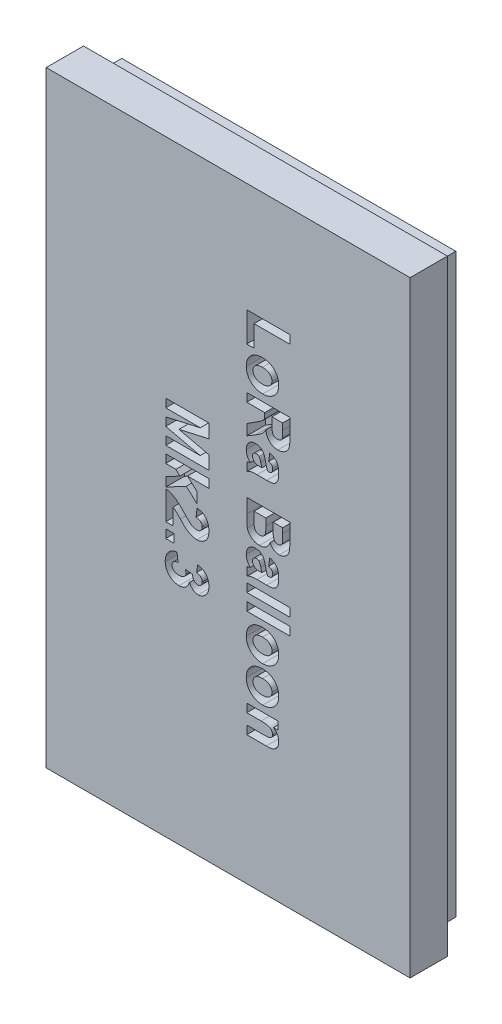
from build123d import *

# Parameters (mm, degrees)
SKETCH1_W   = 39
SKETCH1_H   = 65
BASE_DEPTH  = 4
SKETCH2_W   = 35.8
SKETCH2_H   = 61.8
SKETCH2_W_2 = 32.2
SKETCH2_H_2 = 58.2
MOUNT_DEPTH = 2.5
SKETCH3_W   = 4.622973633
SKETCH3_H   = 0.900579279
SKETCH3_W_2 = 0.900579279
LOGO_DEPTH  = 2


with BuildPart() as part:
    # Sketch1 → Base (new body)
    with BuildSketch(Plane.XY):
        with Locations((19.5, 32.5)):
            Rectangle(SKETCH1_W, SKETCH1_H)
    extrude(amount=BASE_DEPTH)

    # Sketch2 → Mount (add)
    with BuildSketch(Plane(origin=(0, 0, 0), x_dir=(-1, 0, 0), z_dir=(0, 0, -1))):
        with Locations((-19.5, 32.5)):
            Rectangle(SKETCH2_W, SKETCH2_H)
        with Locations((-19.5, 32.5)):
            Rectangle(SKETCH2_W_2, SKETCH2_H_2, mode=Mode.SUBTRACT)
    extrude(amount=MOUNT_DEPTH)

    # Sketch3 → Logo (cut)
    # profile 1 of 16: a face of its own
    with BuildSketch(Plane.XY.offset(4)):
        with BuildLine():
            Line((21.5, 13.827989613), (21.5, 14.728568892))
            Line((21.5, 14.728568892), (23.218605458, 14.728568892))
            add(Edge.make_bspline(
                [(23.218605458, 14.728568892), (23.259881981, 14.728831135), (23.33868675, 14.729331807), (23.451598313, 14.730839729), (23.553850951, 14.734796734), (23.645484529, 14.739400216), (23.726240729, 14.744643751), (23.796064397, 14.751967868), (23.8548999, 14.761242262), (23.918206403, 14.774449165), (23.986420727, 14.797186347), (24.058026651, 14.834969014), (24.120869879, 14.881200737), (24.171139913, 14.938262475), (24.211805696, 15.001178622), (24.241236399, 15.069258199), (24.258624837, 15.141718902), (24.26071657, 15.19127334), (24.261776456, 15.216382668)],
                knots=[0, 0, 0, 0, 1.518468101, 2.899045743, 4.15374029, 5.282521764, 6.274203078, 7.130400985, 7.864176346, 8.464331223, 9.50833919, 10.496277288, 11.432641907, 12.361201578, 13.276990523, 14.178728215, 15.077158116, 16, 16, 16, 16], degree=3))
            add(Edge.make_bspline(
                [(24.261776456, 15.216382668), (24.260395831, 15.249045483), (24.257666872, 15.313607151), (24.234037383, 15.407271244), (24.197101841, 15.496591675), (24.144264328, 15.578920944), (24.080370598, 15.65495619), (24.001643315, 15.716835868), (23.913268019, 15.768500299), (23.829602888, 15.800766323), (23.752735925, 15.819850143), (23.683087132, 15.834354223), (23.601504403, 15.844707565), (23.508648449, 15.854483827), (23.404062142, 15.860137931), (23.288092488, 15.866422281), (23.160451233, 15.868706073), (23.071635516, 15.869098278), (23.025356154, 15.869302646)],
                knots=[0, 0, 0, 0, 0.987208667, 1.951327175, 2.905781144, 3.900987558, 4.900863378, 5.897104334, 6.91491578, 7.990576578, 8.596595857, 9.311207409, 10.142408639, 11.084155198, 12.136793968, 13.311756484, 14.59923223, 16, 16, 16, 16], degree=3))
            Line((23.025356154, 15.869302646), (21.5, 15.869302646))
            Line((21.5, 15.869302646), (21.5, 16.769881925))
            Line((21.5, 16.769881925), (24.862162642, 16.769881925))
            Line((24.862162642, 16.769881925), (24.862162642, 15.929341264))
            Line((24.862162642, 15.929341264), (24.369658349, 15.929341264))
            add(Edge.make_bspline(
                [(24.369658349, 15.929341264), (24.413616533, 15.894934077), (24.49957413, 15.827652883), (24.611985052, 15.713471029), (24.708270507, 15.593463209), (24.786728659, 15.466293298), (24.847225588, 15.331834554), (24.890517621, 15.190698826), (24.917784325, 15.04263487), (24.920714558, 14.941324286), (24.922201261, 14.88992268)],
                knots=[0, 0, 0, 0, 1.093461536, 2.13819855, 3.132977593, 4.104514142, 5.059389303, 6.015385568, 6.993072912, 8, 8, 8, 8], degree=3))
            add(Edge.make_bspline(
                [(24.922201261, 14.88992268), (24.920317919, 14.831313036), (24.91666388, 14.717599245), (24.885696808, 14.553948097), (24.832707603, 14.404772438), (24.760298213, 14.271241837), (24.672194055, 14.154654125), (24.570901367, 14.05627349), (24.456656392, 13.978688927), (24.352110831, 13.929286536), (24.260861224, 13.899872418), (24.185114665, 13.880160253), (24.101698698, 13.864370635), (24.011142966, 13.851834088), (23.913646699, 13.840088199), (23.808775892, 13.832735474), (23.696745732, 13.829517962), (23.619489692, 13.828508526), (23.579775273, 13.827989613)],
                knots=[0, 0, 0, 0, 1.428465185, 2.77149258, 4.042602701, 5.274402086, 6.460971935, 7.593531473, 8.701853732, 9.81394723, 10.399934156, 11.038034574, 11.721500487, 12.468854998, 13.267186475, 14.115831328, 15.031419898, 16, 16, 16, 16], degree=3))
            Line((23.579775273, 13.827989613), (21.5, 13.827989613))
        make_face()
    # profile 2 of 16: a face of its own
    with BuildSketch(Plane.XY.offset(4)):
        with BuildLine():
            add(Edge.make_bspline(
                [(23.227986492, 20.792469371), (23.268340591, 20.791649103), (23.348241235, 20.790024982), (23.466831788, 20.780076026), (23.582597294, 20.760667345), (23.695714536, 20.735577714), (23.806416527, 20.704054597), (23.913363069, 20.662763939), (24.018572563, 20.616656969), (24.119538873, 20.561646768), (24.216642118, 20.502333444), (24.307982668, 20.437575514), (24.392270804, 20.367601326), (24.471764649, 20.295098865), (24.542963196, 20.215915146), (24.610173753, 20.134237696), (24.668761487, 20.046157916), (24.722741328, 19.955376952), (24.769340893, 19.860054279), (24.810963092, 19.762308062), (24.84421655, 19.660597063), (24.874003462, 19.55733923), (24.895076066, 19.45021958), (24.911226693, 19.340690197), (24.920807626, 19.227884963), (24.921733394, 19.151744363), (24.922201261, 19.113264257)],
                knots=[0, 0, 0, 0, 1.087797627, 2.153826546, 3.204146119, 4.249074796, 5.276002369, 6.302929943, 7.33671768, 8.369955531, 9.399197913, 10.402506754, 11.384561342, 12.350717656, 13.299250364, 14.252266119, 15.199037181, 16.147307724, 17.097187567, 18.056740571, 19.008264324, 19.97962709, 20.951574749, 21.948063114, 22.962987564, 24, 24, 24, 24], degree=3))
            add(Edge.make_bspline(
                [(24.922201261, 19.113264257), (24.920492435, 19.049406197), (24.917163302, 18.924997983), (24.89380331, 18.743531178), (24.853287611, 18.572907267), (24.797267351, 18.412070903), (24.72326136, 18.262429877), (24.634810544, 18.12211449), (24.529143938, 17.993062965), (24.40795289, 17.876913485), (24.277240101, 17.77213606), (24.139130934, 17.681191856), (23.996080966, 17.603716584), (23.847473094, 17.540550081), (23.693540221, 17.490172893), (23.533372162, 17.45646932), (23.368435672, 17.433388836), (23.256523789, 17.431342928), (23.199843389, 17.430306729)],
                knots=[0, 0, 0, 0, 1.136040707, 2.213233445, 3.248238065, 4.25119704, 5.236487175, 6.211911138, 7.196384178, 8.195725979, 9.1931767, 10.173001403, 11.133846892, 12.083513917, 13.042376269, 14.010298635, 14.992269034, 16, 16, 16, 16], degree=3))
            add(Edge.make_bspline(
                [(23.199843389, 17.430306729), (23.157599655, 17.430988044), (23.0738988, 17.432337985), (22.949923499, 17.444321062), (22.828866965, 17.461530889), (22.710806659, 17.487328516), (22.595913097, 17.519608262), (22.484212787, 17.560631027), (22.375843769, 17.608314659), (22.270645012, 17.662470291), (22.171228883, 17.723480762), (22.076479739, 17.787925195), (21.989613644, 17.858593723), (21.908343846, 17.933026069), (21.833120613, 18.011749179), (21.764474284, 18.095492707), (21.702322369, 18.1838856), (21.647348245, 18.276666737), (21.598380596, 18.372514362), (21.556075444, 18.471239084), (21.52061437, 18.572238067), (21.49154767, 18.675378154), (21.4673821, 18.780414605), (21.452433072, 18.888433003), (21.441007522, 18.998259779), (21.440311587, 19.072269111), (21.439961381, 19.109511844)],
                knots=[0, 0, 0, 0, 1.117558833, 2.214307803, 3.293244786, 4.351421184, 5.409597582, 6.448807362, 7.497331125, 8.540978692, 9.576922014, 10.582241184, 11.570837346, 12.537122916, 13.496974449, 14.449450387, 15.399839374, 16.353464778, 17.300823134, 18.246083241, 19.193441597, 20.131138339, 21.080698472, 22.042616426, 23.015011865, 24, 24, 24, 24], degree=3))
            add(Edge.make_bspline(
                [(21.439961381, 19.109511844), (21.441434818, 19.168676914), (21.444329398, 19.284907241), (21.466190044, 19.455499274), (21.502637169, 19.618208719), (21.553836141, 19.773292057), (21.618260134, 19.921111712), (21.698440035, 20.060830211), (21.79447105, 20.191671601), (21.902499007, 20.315346139), (22.024251963, 20.428480511), (22.159878703, 20.526179772), (22.308067385, 20.608407676), (22.468125433, 20.676011805), (22.640780217, 20.728460395), (22.825794291, 20.76565684), (23.022910429, 20.788417035), (23.158504181, 20.79109639), (23.227986492, 20.792469371)],
                knots=[0, 0, 0, 0, 1.024594995, 2.012826322, 2.973358778, 3.908543225, 4.837401023, 5.761810751, 6.69243552, 7.644223827, 8.602462928, 9.564551743, 10.532007457, 11.531954493, 12.568505162, 13.651979317, 14.796803673, 16, 16, 16, 16], degree=3))
        make_face()
        with BuildLine():
            add(Edge.make_bspline(
                [(23.181081321, 19.891890092), (23.140418132, 19.891081204), (23.061457429, 19.889510486), (22.946509384, 19.879930059), (22.839622498, 19.86021699), (22.739486697, 19.837275165), (22.647961982, 19.803332482), (22.563118232, 19.76475678), (22.486368037, 19.717306566), (22.418159022, 19.662990028), (22.358227437, 19.603526395), (22.305063926, 19.541372853), (22.260023454, 19.476171936), (22.223835025, 19.407386441), (22.195763008, 19.335913587), (22.174765469, 19.261215875), (22.162389452, 19.183413262), (22.161082475, 19.130506093), (22.160424805, 19.103883223)],
                knots=[0, 0, 0, 0, 1.347985487, 2.617548842, 3.817114289, 4.948286482, 6.017057593, 7.046407217, 8.032969353, 8.999289909, 9.930051738, 10.827140183, 11.706817169, 12.550594062, 13.397420762, 14.247349517, 15.118066881, 16, 16, 16, 16], degree=3))
            add(Edge.make_bspline(
                [(22.160424805, 19.103883223), (22.161082172, 19.077884544), (22.162388524, 19.026218755), (22.174768649, 18.950280251), (22.195758212, 18.877442866), (22.224167513, 18.807226876), (22.260561859, 18.739594255), (22.306359128, 18.675696195), (22.359147439, 18.61418118), (22.42010437, 18.556389987), (22.488357165, 18.502259842), (22.565874129, 18.456493853), (22.650982245, 18.418080105), (22.743354127, 18.386304717), (22.843361939, 18.360760783), (22.951359004, 18.343351788), (23.067059726, 18.333127611), (23.146662829, 18.331647878), (23.187648045, 18.330886009)],
                knots=[0, 0, 0, 0, 0.86498205, 1.718932724, 2.552529207, 3.383717481, 4.236080589, 5.102502034, 5.995588818, 6.930639414, 7.894730959, 8.889086482, 9.918564038, 10.998334367, 12.1369617, 13.350269694, 14.635734454, 16, 16, 16, 16], degree=3))
            add(Edge.make_bspline(
                [(23.187648045, 18.330886009), (23.227688932, 18.331684219), (23.305407142, 18.333233522), (23.418448526, 18.342948554), (23.523973479, 18.362246362), (23.622320571, 18.387010265), (23.713524667, 18.419080565), (23.797316766, 18.458372586), (23.873991238, 18.505367542), (23.942107737, 18.560129899), (24.003044034, 18.618891112), (24.055828048, 18.681339245), (24.101619145, 18.746185087), (24.138009283, 18.814749178), (24.166408615, 18.885901469), (24.187393837, 18.959673844), (24.199774112, 19.036543003), (24.201080471, 19.088829606), (24.201737837, 19.115140464)],
                knots=[0, 0, 0, 0, 1.337232047, 2.595528913, 3.783536199, 4.915617704, 5.97906533, 7.006690339, 8.000659516, 8.974235141, 9.919454987, 10.823278711, 11.700968276, 12.565199868, 13.408680491, 14.254935835, 15.121875735, 16, 16, 16, 16], degree=3))
            add(Edge.make_bspline(
                [(24.201737837, 19.115140464), (24.201125638, 19.141458654), (24.199923414, 19.193141825), (24.187117275, 19.269303374), (24.1666105, 19.342265893), (24.137959369, 19.412718986), (24.10165055, 19.480405772), (24.055496899, 19.544317908), (24.003354012, 19.606692169), (23.942036507, 19.664507638), (23.873587127, 19.718599202), (23.796542842, 19.765081165), (23.712370979, 19.804891994), (23.620397249, 19.836579931), (23.521262796, 19.861774997), (23.414268616, 19.879544071), (23.300102491, 19.889596023), (23.221439565, 19.891112209), (23.181081321, 19.891890092)],
                knots=[0, 0, 0, 0, 0.8777483, 1.723705717, 2.56959874, 3.403036217, 4.257705828, 5.126471818, 6.029908573, 6.967489424, 7.934189811, 8.936630112, 9.963815147, 11.036651848, 12.178360317, 13.374360467, 14.652907978, 16, 16, 16, 16], degree=3))
        make_face(mode=Mode.SUBTRACT)
    # profile 3 of 16: a face of its own
    with BuildSketch(Plane.XY.offset(4)):
        with BuildLine():
            add(Edge.make_bspline(
                [(23.227986492, 24.634940962), (23.268340591, 24.634120694), (23.348241235, 24.632496573), (23.466831788, 24.622547617), (23.582597294, 24.603138936), (23.695714536, 24.578049305), (23.806416527, 24.546526188), (23.913363069, 24.50523553), (24.018572563, 24.45912856), (24.119538873, 24.404118359), (24.216642118, 24.344805035), (24.307982668, 24.280047105), (24.392270804, 24.210072917), (24.471764649, 24.137570456), (24.542963196, 24.058386737), (24.610173753, 23.976709287), (24.668761487, 23.888629507), (24.722741328, 23.797848543), (24.769340893, 23.70252587), (24.810963092, 23.604779653), (24.84421655, 23.503068653), (24.874003462, 23.399810821), (24.895076066, 23.292691171), (24.911226693, 23.183161788), (24.920807626, 23.070356554), (24.921733394, 22.994215954), (24.922201261, 22.955735848)],
                knots=[0, 0, 0, 0, 1.087797627, 2.153826546, 3.204146119, 4.249074796, 5.276002369, 6.302929943, 7.33671768, 8.369955531, 9.399197913, 10.402506754, 11.384561342, 12.350717656, 13.299250364, 14.252266119, 15.199037181, 16.147307724, 17.097187567, 18.056740571, 19.008264324, 19.97962709, 20.951574749, 21.948063114, 22.962987564, 24, 24, 24, 24], degree=3))
            add(Edge.make_bspline(
                [(24.922201261, 22.955735848), (24.920492435, 22.891877788), (24.917163302, 22.767469574), (24.89380331, 22.586002768), (24.853287611, 22.415378858), (24.797267351, 22.254542494), (24.72326136, 22.104901468), (24.634810544, 21.964586081), (24.529143938, 21.835534556), (24.40795289, 21.719385076), (24.277240101, 21.614607651), (24.139130934, 21.523663446), (23.996080966, 21.446188175), (23.847473094, 21.383021672), (23.693540221, 21.332644484), (23.533372162, 21.298940911), (23.368435672, 21.275860427), (23.256523789, 21.273814519), (23.199843389, 21.27277832)],
                knots=[0, 0, 0, 0, 1.136040707, 2.213233445, 3.248238065, 4.25119704, 5.236487175, 6.211911138, 7.196384178, 8.195725979, 9.1931767, 10.173001403, 11.133846892, 12.083513917, 13.042376269, 14.010298635, 14.992269034, 16, 16, 16, 16], degree=3))
            add(Edge.make_bspline(
                [(23.199843389, 21.27277832), (23.157599655, 21.273459635), (23.0738988, 21.274809576), (22.949923499, 21.286792653), (22.828866965, 21.30400248), (22.710806659, 21.329800107), (22.595913097, 21.362079853), (22.484212787, 21.403102618), (22.375843769, 21.45078625), (22.270645012, 21.504941881), (22.171228883, 21.565952353), (22.076479739, 21.630396786), (21.989613644, 21.701065314), (21.908343846, 21.77549766), (21.833120613, 21.85422077), (21.764474284, 21.937964298), (21.702322369, 22.026357191), (21.647348245, 22.119138328), (21.598380596, 22.214985953), (21.556075444, 22.313710675), (21.52061437, 22.414709658), (21.49154767, 22.517849745), (21.4673821, 22.622886196), (21.452433072, 22.730904594), (21.441007522, 22.84073137), (21.440311587, 22.914740702), (21.439961381, 22.951983435)],
                knots=[0, 0, 0, 0, 1.117558833, 2.214307803, 3.293244786, 4.351421184, 5.409597582, 6.448807362, 7.497331125, 8.540978692, 9.576922014, 10.582241184, 11.570837346, 12.537122916, 13.496974449, 14.449450387, 15.399839374, 16.353464778, 17.300823134, 18.246083241, 19.193441597, 20.131138339, 21.080698472, 22.042616426, 23.015011865, 24, 24, 24, 24], degree=3))
            add(Edge.make_bspline(
                [(21.439961381, 22.951983435), (21.441434818, 23.011148505), (21.444329398, 23.127378832), (21.466190044, 23.297970865), (21.502637169, 23.46068031), (21.553836141, 23.615763648), (21.618260134, 23.763583303), (21.698440035, 23.903301802), (21.79447105, 24.034143192), (21.902499007, 24.15781773), (22.024251963, 24.270952101), (22.159878703, 24.368651363), (22.308067385, 24.450879267), (22.468125433, 24.518483396), (22.640780217, 24.570931986), (22.825794291, 24.608128431), (23.022910429, 24.630888625), (23.158504181, 24.63356798), (23.227986492, 24.634940962)],
                knots=[0, 0, 0, 0, 1.024594995, 2.012826322, 2.973358778, 3.908543225, 4.837401023, 5.761810751, 6.69243552, 7.644223827, 8.602462928, 9.564551743, 10.532007457, 11.531954493, 12.568505162, 13.651979317, 14.796803673, 16, 16, 16, 16], degree=3))
        make_face()
        with BuildLine():
            add(Edge.make_bspline(
                [(23.181081321, 23.734361683), (23.140418132, 23.733552795), (23.061457429, 23.731982077), (22.946509384, 23.72240165), (22.839622498, 23.70268858), (22.739486697, 23.679746756), (22.647961982, 23.645804072), (22.563118232, 23.607228371), (22.486368037, 23.559778157), (22.418159022, 23.505461619), (22.358227437, 23.445997986), (22.305063926, 23.383844444), (22.260023454, 23.318643527), (22.223835025, 23.249858032), (22.195763008, 23.178385178), (22.174765469, 23.103687466), (22.162389452, 23.025884853), (22.161082475, 22.972977683), (22.160424805, 22.946354814)],
                knots=[0, 0, 0, 0, 1.347985487, 2.617548842, 3.817114289, 4.948286482, 6.017057593, 7.046407217, 8.032969353, 8.999289909, 9.930051738, 10.827140183, 11.706817169, 12.550594062, 13.397420762, 14.247349517, 15.118066881, 16, 16, 16, 16], degree=3))
            add(Edge.make_bspline(
                [(22.160424805, 22.946354814), (22.161082172, 22.920356135), (22.162388524, 22.868690346), (22.174768649, 22.792751842), (22.195758212, 22.719914457), (22.224167513, 22.649698467), (22.260561859, 22.582065846), (22.306359128, 22.518167786), (22.359147439, 22.456652771), (22.42010437, 22.398861578), (22.488357165, 22.344731433), (22.565874129, 22.298965444), (22.650982245, 22.260551696), (22.743354127, 22.228776308), (22.843361939, 22.203232374), (22.951359004, 22.185823379), (23.067059726, 22.175599201), (23.146662829, 22.174119469), (23.187648045, 22.173357599)],
                knots=[0, 0, 0, 0, 0.86498205, 1.718932724, 2.552529207, 3.383717481, 4.236080589, 5.102502034, 5.995588818, 6.930639414, 7.894730959, 8.889086482, 9.918564038, 10.998334367, 12.1369617, 13.350269694, 14.635734454, 16, 16, 16, 16], degree=3))
            add(Edge.make_bspline(
                [(23.187648045, 22.173357599), (23.227688932, 22.17415581), (23.305407142, 22.175705113), (23.418448526, 22.185420145), (23.523973479, 22.204717953), (23.622320571, 22.229481856), (23.713524667, 22.261552156), (23.797316766, 22.300844177), (23.873991238, 22.347839133), (23.942107737, 22.40260149), (24.003044034, 22.461362702), (24.055828048, 22.523810836), (24.101619145, 22.588656678), (24.138009283, 22.657220769), (24.166408615, 22.72837306), (24.187393837, 22.802145435), (24.199774112, 22.879014594), (24.201080471, 22.931301197), (24.201737837, 22.957612055)],
                knots=[0, 0, 0, 0, 1.337232047, 2.595528913, 3.783536199, 4.915617704, 5.97906533, 7.006690339, 8.000659516, 8.974235141, 9.919454987, 10.823278711, 11.700968276, 12.565199868, 13.408680491, 14.254935835, 15.121875735, 16, 16, 16, 16], degree=3))
            add(Edge.make_bspline(
                [(24.201737837, 22.957612055), (24.201125638, 22.983930245), (24.199923414, 23.035613416), (24.187117275, 23.111774965), (24.1666105, 23.184737484), (24.137959369, 23.255190577), (24.10165055, 23.322877363), (24.055496899, 23.386789499), (24.003354012, 23.44916376), (23.942036507, 23.506979229), (23.873587127, 23.561070793), (23.796542842, 23.607552756), (23.712370979, 23.647363585), (23.620397249, 23.679051522), (23.521262796, 23.704246588), (23.414268616, 23.722015661), (23.300102491, 23.732067614), (23.221439565, 23.7335838), (23.181081321, 23.734361683)],
                knots=[0, 0, 0, 0, 0.8777483, 1.723705717, 2.56959874, 3.403036217, 4.257705828, 5.126471818, 6.029908573, 6.967489424, 7.934189811, 8.936630112, 9.963815147, 11.036651848, 12.178360317, 13.374360467, 14.652907978, 16, 16, 16, 16], degree=3))
        make_face(mode=Mode.SUBTRACT)
    # profile 4 of 16: a face of its own
    with BuildSketch(Plane.XY.offset(4)):
        with Locations((23.811486817, 25.745655406)):
            Rectangle(SKETCH3_W, SKETCH3_H)
    # profile 5 of 16: a face of its own
    with BuildSketch(Plane.XY.offset(4)):
        with Locations((23.811486817, 27.486775347)):
            Rectangle(SKETCH3_W, SKETCH3_H)
    # profile 6 of 16: a face of its own
    with BuildSketch(Plane.XY.offset(4)):
        with BuildLine():
            Line((23.841506126, 30.638802823), (23.961583363, 31.479343484))
            add(Edge.make_bspline(
                [(23.961583363, 31.479343484), (24.003056427, 31.467434884), (24.08373433, 31.444268983), (24.198162111, 31.400551039), (24.30438426, 31.3531243), (24.401073835, 31.298316963), (24.489620864, 31.238904055), (24.568113139, 31.172394984), (24.637964286, 31.100860483), (24.699606916, 31.023428652), (24.752828321, 30.938369475), (24.798705368, 30.845357253), (24.837141958, 30.743523555), (24.867740873, 30.633201353), (24.892075182, 30.514403588), (24.909807303, 30.386900818), (24.919932697, 30.250592402), (24.921430674, 30.156947162), (24.922201261, 30.108774393)],
                knots=[0, 0, 0, 0, 1.125515524, 2.189474865, 3.193709533, 4.158305409, 5.086274303, 5.972285183, 6.837881566, 7.691743787, 8.549806887, 9.451203831, 10.393874208, 11.385866739, 12.435713252, 13.556277782, 14.742906037, 16, 16, 16, 16], degree=3))
            add(Edge.make_bspline(
                [(24.922201261, 30.108774393), (24.921986052, 30.065921316), (24.921567926, 29.982662472), (24.914195236, 29.861645018), (24.905701633, 29.74824523), (24.891648419, 29.642685396), (24.872802431, 29.545050247), (24.850656262, 29.455041183), (24.824366297, 29.372896772), (24.785361186, 29.276002851), (24.72686919, 29.169204553), (24.645227411, 29.057207756), (24.550150903, 28.966072722), (24.460504459, 28.90481776), (24.378336951, 28.866974433), (24.305144759, 28.843415045), (24.220833774, 28.822683293), (24.12519058, 28.806274871), (24.01811083, 28.793317927), (23.899799318, 28.784196603), (23.770265296, 28.778566263), (23.680158536, 28.777934536), (23.633247167, 28.777605646)],
                knots=[0, 0, 0, 0, 1.172645795, 2.278322549, 3.317437237, 4.284552983, 5.190951134, 6.037858116, 6.820064311, 7.549551753, 8.893788561, 10.141635195, 11.328036199, 12.481663495, 13.094362176, 13.79803918, 14.582676335, 15.469136844, 16.45214095, 17.533908717, 18.716103928, 20, 20, 20, 20], degree=3))
            Line((23.633247167, 28.777605646), (22.599457203, 28.785110474))
            add(Edge.make_bspline(
                [(22.599457203, 28.785110474), (22.564435728, 28.784818492), (22.496576972, 28.784252739), (22.398330909, 28.783095969), (22.307040045, 28.777889516), (22.222621106, 28.772207638), (22.144878475, 28.76652144), (22.074326469, 28.756430481), (22.010639761, 28.746784696), (21.934153527, 28.730094941), (21.841504636, 28.702291713), (21.729923806, 28.658887688), (21.614669352, 28.604317298), (21.539082625, 28.560241078), (21.5, 28.537451172)],
                knots=[0, 0, 0, 0, 1.100960395, 2.13325684, 3.08799504, 3.974623839, 4.793377983, 5.537123068, 6.214225653, 6.817686965, 7.996461938, 9.250537039, 10.578371695, 12, 12, 12, 12], degree=3))
            Line((21.5, 28.537451172), (21.5, 29.438030451))
            Line((21.5, 29.438030451), (21.867736539, 29.547788551))
            add(Edge.make_bspline(
                [(21.867736539, 29.547788551), (21.83226304, 29.584006044), (21.763238807, 29.654477941), (21.674416477, 29.769585627), (21.599695505, 29.887759295), (21.540260444, 30.010615085), (21.494849843, 30.137413333), (21.463178517, 30.267925881), (21.443827041, 30.402447406), (21.441261018, 30.493332495), (21.439961381, 30.539363861)],
                knots=[0, 0, 0, 0, 1.094238684, 2.129166538, 3.133671034, 4.10942336, 5.070833053, 6.037377746, 7.005973528, 8, 8, 8, 8], degree=3))
            add(Edge.make_bspline(
                [(21.439961381, 30.539363861), (21.441007341, 30.577227798), (21.443061457, 30.65158714), (21.454903777, 30.760620952), (21.476538098, 30.864236462), (21.507054288, 30.962247595), (21.543951561, 31.055845697), (21.591661801, 31.143446331), (21.646964549, 31.226252714), (21.71053094, 31.303249219), (21.781922723, 31.371935179), (21.857738316, 31.434326956), (21.941277911, 31.484189382), (22.028844016, 31.527786574), (22.123266364, 31.558678968), (22.222597532, 31.582717898), (22.327631273, 31.596791117), (22.399600412, 31.598533819), (22.436227209, 31.599420721)],
                knots=[0, 0, 0, 0, 1.111028414, 2.181900458, 3.212888925, 4.21115239, 5.190734394, 6.159429897, 7.131421471, 8.108723925, 9.081883785, 10.034678926, 10.981892532, 11.929727932, 12.898727489, 13.888948844, 14.925636122, 16, 16, 16, 16], degree=3))
            add(Edge.make_bspline(
                [(22.436227209, 31.599420721), (22.482593242, 31.597985519), (22.572724924, 31.595195608), (22.703283791, 31.573406202), (22.824622959, 31.53700393), (22.936022841, 31.484752685), (23.037479655, 31.419989423), (23.129142785, 31.343137329), (23.208842276, 31.253160364), (23.267148448, 31.168737507), (23.309753926, 31.093237314), (23.338835724, 31.027015478), (23.369441505, 30.954257607), (23.396985309, 30.87273707), (23.425368881, 30.783762868), (23.452494502, 30.686499334), (23.4774731, 30.580842949), (23.493569489, 30.507802883), (23.501912689, 30.469944208)],
                knots=[0, 0, 0, 0, 1.294162278, 2.515743014, 3.684113667, 4.820865117, 5.939906549, 7.036651616, 8.149715676, 9.285662014, 9.895437351, 10.567486448, 11.303637924, 12.098932185, 12.968810962, 13.91153998, 14.917493754, 16, 16, 16, 16], degree=3))
            add(Edge.make_bspline(
                [(23.501912689, 30.469944208), (23.511407002, 30.424245964), (23.529650374, 30.336436551), (23.559131352, 30.210564084), (23.587017816, 30.095417656), (23.61413993, 29.990851432), (23.640930358, 29.897172382), (23.668501435, 29.814489463), (23.694085633, 29.742248576), (23.712787099, 29.698432134), (23.721428888, 29.678184925)],
                knots=[0, 0, 0, 0, 1.361164628, 2.615484881, 3.770095419, 4.816364149, 5.765912261, 6.610903979, 7.358110453, 8, 8, 8, 8], degree=3))
            add(Edge.make_bspline(
                [(23.721428888, 29.678184925), (23.76207844, 29.6788442), (23.835936364, 29.680042064), (23.93546068, 29.685376179), (24.012171286, 29.696916583), (24.070146149, 29.713057124), (24.113156329, 29.739644454), (24.150196809, 29.771496823), (24.18179134, 29.812907472), (24.210776693, 29.861616543), (24.234039299, 29.92037058), (24.250744994, 29.989451147), (24.259418855, 30.069157144), (24.260957962, 30.125641382), (24.261776456, 30.155679564)],
                knots=[0, 0, 0, 0, 1.704637254, 3.09722893, 4.172654963, 4.956246112, 5.596985007, 6.275246559, 6.99385986, 7.769515704, 8.645866914, 9.631493719, 10.740434052, 12, 12, 12, 12], degree=3))
            add(Edge.make_bspline(
                [(24.261776456, 30.155679564), (24.260884607, 30.186431839), (24.25919465, 30.244704049), (24.241526382, 30.326789234), (24.215410217, 30.399541536), (24.174002857, 30.462139553), (24.117664666, 30.516983978), (24.042764104, 30.564336903), (23.949087652, 30.606208167), (23.879011929, 30.627439452), (23.841506126, 30.638802823)],
                knots=[0, 0, 0, 0, 1.045871977, 1.981813381, 2.848317391, 3.663751395, 4.514929533, 5.507645304, 6.666046366, 8, 8, 8, 8], degree=3))
        make_face()
        with BuildLine():
            add(Edge.make_bspline(
                [(23.121042702, 29.678184925), (23.111478433, 29.705642117), (23.090198568, 29.76673255), (23.059474829, 29.869355085), (23.027018533, 29.992468647), (23.005193715, 30.081531992), (22.993460638, 30.129412668)],
                knots=[0, 0, 0, 0, 0.743632693, 1.654533494, 2.73907137, 4, 4, 4, 4], degree=3))
            add(Edge.make_bspline(
                [(22.993460638, 30.129412668), (22.98653897, 30.157630661), (22.97332241, 30.211511434), (22.950053418, 30.287845517), (22.928514853, 30.357132685), (22.904326783, 30.418406112), (22.881777826, 30.472835021), (22.857166421, 30.519213871), (22.832210074, 30.558037431), (22.813567384, 30.579872176), (22.804901851, 30.590021446)],
                knots=[0, 0, 0, 0, 1.388607462, 2.65147299, 3.814389992, 4.855436495, 5.799565367, 6.62877246, 7.362623276, 8, 8, 8, 8], degree=3))
            add(Edge.make_bspline(
                [(22.804901851, 30.590021446), (22.787150786, 30.606905989), (22.752087496, 30.640257657), (22.686643373, 30.674142055), (22.614581201, 30.695615065), (22.563658271, 30.697747711), (22.537542378, 30.698841442)],
                knots=[0, 0, 0, 0, 0.985740837, 1.947112291, 2.947173789, 4, 4, 4, 4], degree=3))
            add(Edge.make_bspline(
                [(22.537542378, 30.698841442), (22.50766342, 30.697552629), (22.449801672, 30.695056792), (22.366786442, 30.67109689), (22.290760217, 30.633756865), (22.224593068, 30.5805644), (22.168585191, 30.517844011), (22.129814521, 30.443898244), (22.103890852, 30.363475292), (22.101569181, 30.306608945), (22.100386186, 30.277633008)],
                knots=[0, 0, 0, 0, 1.056198986, 2.045369905, 3.036276429, 4.038084886, 5.035473036, 5.992159802, 6.976916006, 8, 8, 8, 8], degree=3))
            add(Edge.make_bspline(
                [(22.100386186, 30.277633008), (22.101736527, 30.250638273), (22.104453435, 30.196324423), (22.124157539, 30.115269235), (22.156784545, 30.035146667), (22.200051148, 29.95689915), (22.252073425, 29.885034273), (22.311090427, 29.824046343), (22.374225547, 29.774507895), (22.432190619, 29.742578585), (22.484079963, 29.723699062), (22.530121172, 29.712238539), (22.5827991, 29.700346865), (22.642798398, 29.692660687), (22.709733915, 29.685972628), (22.78390109, 29.681483599), (22.865230729, 29.678668637), (22.921849407, 29.678350239), (22.951245984, 29.678184925)],
                knots=[0, 0, 0, 0, 1.093500888, 2.200141778, 3.360346716, 4.591280596, 5.815607582, 6.94487563, 8.019710678, 9.057444999, 9.610729159, 10.253199895, 10.979011171, 11.798077413, 12.702238226, 13.705425431, 14.808650418, 16, 16, 16, 16], degree=3))
            Line((22.951245984, 29.678184925), (23.121042702, 29.678184925))
        make_face(mode=Mode.SUBTRACT)
    # profile 7 of 16: a face of its own
    with BuildSketch(Plane.XY.offset(4)):
        with BuildLine():
            Line((26.122973633, 35.862162642), (26.122973633, 34.034737188))
            add(Edge.make_bspline(
                [(26.122973633, 34.034737188), (26.122521051, 33.974697566), (26.121651102, 33.859289843), (26.117632998, 33.692833959), (26.108005759, 33.540518244), (26.095757541, 33.401965766), (26.081840746, 33.277153482), (26.061533426, 33.166211895), (26.040180572, 33.068710459), (26.0049456, 32.958208415), (25.948462842, 32.833859585), (25.859088002, 32.698498313), (25.748544411, 32.574914981), (25.640427701, 32.484366381), (25.545807025, 32.419569514), (25.471963858, 32.375962378), (25.394724771, 32.34050274), (25.315529677, 32.311621856), (25.2346417, 32.287265516), (25.150572045, 32.272227397), (25.064475175, 32.260896126), (25.006044505, 32.260197463), (24.976611259, 32.259845526)],
                knots=[0, 0, 0, 0, 1.498327689, 2.88007457, 4.154414764, 5.305986542, 6.351317343, 7.286582663, 8.11946184, 8.840080679, 10.177555878, 11.512935148, 12.872513647, 14.301275782, 15.019863751, 15.733221227, 16.438466007, 17.137161526, 17.836031326, 18.543086972, 19.26611006, 20, 20, 20, 20], degree=3))
            add(Edge.make_bspline(
                [(24.976611259, 32.259845526), (24.922946761, 32.261915748), (24.817024149, 32.266001938), (24.662821857, 32.301323406), (24.51596526, 32.356750779), (24.380113254, 32.435941393), (24.256588311, 32.532155702), (24.148778926, 32.642960741), (24.056681459, 32.766389832), (24.011500867, 32.858179472), (23.988788362, 32.904322572)],
                knots=[0, 0, 0, 0, 1.031817477, 2.036594177, 3.029254201, 4.043130586, 5.050931669, 6.034203586, 7.01178454, 8, 8, 8, 8], degree=3))
            add(Edge.make_bspline(
                [(23.988788362, 32.904322572), (23.978291223, 32.872889058), (23.957542489, 32.81075731), (23.919057509, 32.721600226), (23.874445181, 32.637986518), (23.826159834, 32.558435217), (23.770442173, 32.4855306), (23.709973461, 32.417774097), (23.645321829, 32.353992342), (23.573797837, 32.297708092), (23.499063042, 32.245250348), (23.418797393, 32.201509078), (23.335071516, 32.163856608), (23.247401209, 32.132424024), (23.155229507, 32.109421239), (23.059306459, 32.092555007), (22.959608937, 32.082004401), (22.891858621, 32.080496044), (22.857435643, 32.07972967)],
                knots=[0, 0, 0, 0, 1.053917501, 2.08318216, 3.084375989, 4.067115349, 5.039987852, 5.998256831, 6.954975631, 7.924383767, 8.890110205, 9.856297623, 10.826929889, 11.808561028, 12.814635272, 13.844956918, 14.905053061, 16, 16, 16, 16], degree=3))
            add(Edge.make_bspline(
                [(22.857435643, 32.07972967), (22.815500063, 32.080674782), (22.733295748, 32.082527439), (22.612472135, 32.095790753), (22.496620731, 32.118170344), (22.385911071, 32.150194291), (22.279951486, 32.190584806), (22.179119697, 32.240535576), (22.083315073, 32.29998627), (21.992730779, 32.367260776), (21.90919217, 32.440619529), (21.833589227, 32.518325357), (21.765489185, 32.598540712), (21.707581308, 32.683744533), (21.656528591, 32.770929209), (21.61374927, 32.86140744), (21.581005615, 32.955663375), (21.565164633, 33.020195867), (21.557224308, 33.052542912)],
                knots=[0, 0, 0, 0, 1.145607172, 2.24567906, 3.316329682, 4.365460088, 5.390414304, 6.410550385, 7.434792233, 8.46684308, 9.489944109, 10.468671886, 11.426900475, 12.36059261, 13.279351643, 14.185149476, 15.09030244, 16, 16, 16, 16], degree=3))
            add(Edge.make_bspline(
                [(21.557224308, 33.052542912), (21.552629506, 33.07908897), (21.542179673, 33.13946194), (21.530238938, 33.242119817), (21.521967062, 33.367377552), (21.512784829, 33.515239812), (21.508239794, 33.685752819), (21.503113461, 33.878985836), (21.500511164, 34.094769247), (21.500175925, 34.246122814), (21.5, 34.325549247)],
                knots=[0, 0, 0, 0, 0.506837559, 1.152686718, 1.943271314, 2.868501158, 3.939884368, 5.152247396, 6.505573166, 8, 8, 8, 8], degree=3))
            Line((21.5, 34.325549247), (21.5, 35.862162642))
            Line((21.5, 35.862162642), (26.122973633, 35.862162642))
        make_face()
        with BuildLine():
            Line((25.342471591, 34.961583363), (24.321815075, 34.961583363))
            Line((24.321815075, 34.961583363), (24.321815075, 34.348063729))
            add(Edge.make_bspline(
                [(24.321815075, 34.348063729), (24.321708304, 34.304284997), (24.321505436, 34.221104166), (24.322860414, 34.102907764), (24.323271951, 33.997826783), (24.325612076, 33.905907404), (24.326868369, 33.827384284), (24.330184865, 33.762062962), (24.332255296, 33.709756523), (24.33545221, 33.679186893), (24.336824729, 33.666062546)],
                knots=[0, 0, 0, 0, 1.539755574, 2.925579234, 4.157432792, 5.235486124, 6.159601295, 6.919197766, 7.535983151, 8, 8, 8, 8], degree=3))
            add(Edge.make_bspline(
                [(24.336824729, 33.666062546), (24.342990913, 33.628312442), (24.354742688, 33.55636669), (24.388025395, 33.455517162), (24.433788831, 33.367853936), (24.491801151, 33.292608974), (24.562445267, 33.232645216), (24.646094328, 33.190645551), (24.740542137, 33.164658631), (24.807575483, 33.161874029), (24.84246247, 33.160424805)],
                knots=[0, 0, 0, 0, 1.156043088, 2.203236031, 3.197816213, 4.134692963, 5.061434266, 5.975433912, 6.946330216, 8, 8, 8, 8], degree=3))
            add(Edge.make_bspline(
                [(24.84246247, 33.160424805), (24.873876263, 33.16143657), (24.934019538, 33.163373646), (25.019351721, 33.185057414), (25.096016804, 33.218550179), (25.161935885, 33.267235164), (25.216357618, 33.325420892), (25.262093272, 33.388841806), (25.293723027, 33.459215139), (25.3117268, 33.524246926), (25.321477076, 33.58764863), (25.325841476, 33.653854114), (25.332380205, 33.738200407), (25.334869957, 33.840558427), (25.339580253, 33.96121658), (25.340377663, 34.099784337), (25.343094236, 34.256433488), (25.342686451, 34.36682405), (25.342471591, 34.424988209)],
                knots=[0, 0, 0, 0, 0.973031789, 1.862917975, 2.714444411, 3.555113712, 4.385861934, 5.180259999, 5.970734499, 6.766732084, 7.267820327, 7.959442945, 8.825288207, 9.893716152, 11.136763095, 12.573466007, 14.194578749, 16, 16, 16, 16], degree=3))
            Line((25.342471591, 34.424988209), (25.342471591, 34.961583363))
        make_face(mode=Mode.SUBTRACT)
        with BuildLine():
            Line((23.541313033, 34.961583363), (22.280502042, 34.961583363))
            Line((22.280502042, 34.961583363), (22.280502042, 34.121042702))
            add(Edge.make_bspline(
                [(22.280502042, 34.121042702), (22.280760428, 34.076951782), (22.281253401, 33.992831182), (22.282800025, 33.873042497), (22.286518536, 33.765762738), (22.291887116, 33.670642455), (22.299557696, 33.587797388), (22.307251331, 33.517227442), (22.317857629, 33.459395647), (22.331738252, 33.39865042), (22.35944942, 33.333742936), (22.402845831, 33.263847564), (22.458232543, 33.19982963), (22.525607831, 33.143947979), (22.604204685, 33.097430306), (22.693207476, 33.063542457), (22.79246554, 33.043737151), (22.861720576, 33.041508028), (22.897774089, 33.040347567)],
                knots=[0, 0, 0, 0, 1.468823539, 2.802352852, 3.990613231, 5.044577628, 5.97542194, 6.762296442, 7.407977832, 7.933490854, 8.834961323, 9.742609811, 10.665728169, 11.642033707, 12.646065455, 13.694610711, 14.799836276, 16, 16, 16, 16], degree=3))
            add(Edge.make_bspline(
                [(22.897774089, 33.040347567), (22.93476601, 33.04184352), (23.005924698, 33.044721174), (23.107872413, 33.065134911), (23.199388257, 33.101055507), (23.279963622, 33.151577569), (23.349625379, 33.213579295), (23.407243483, 33.285981274), (23.454309014, 33.3668817), (23.482516024, 33.443340654), (23.49973763, 33.513954455), (23.510234486, 33.579903895), (23.521102124, 33.657684987), (23.527554048, 33.748264023), (23.534829997, 33.850771841), (23.5376358, 33.965937524), (23.540957195, 34.093193334), (23.541190876, 34.182328837), (23.541313033, 34.228924595)],
                knots=[0, 0, 0, 0, 1.143215143, 2.19912046, 3.197116365, 4.165365694, 5.123819291, 6.065802965, 7.014162653, 8.005206416, 8.5725482, 9.259043701, 10.068343003, 10.999502645, 12.064921609, 13.244816419, 14.559722402, 16, 16, 16, 16], degree=3))
            Line((23.541313033, 34.228924595), (23.541313033, 34.961583363))
        make_face(mode=Mode.SUBTRACT)
    # profile 8 of 16: a face of its own
    with BuildSketch(Plane.XY.offset(4)):
        with BuildLine():
            Line((23.841506126, 40.365059038), (23.961583363, 41.205599698))
            add(Edge.make_bspline(
                [(23.961583363, 41.205599698), (24.003056427, 41.193691098), (24.08373433, 41.170525198), (24.198162111, 41.126807254), (24.30438426, 41.079380514), (24.401073835, 41.024573178), (24.489620864, 40.965160269), (24.568113139, 40.898651198), (24.637964286, 40.827116697), (24.699606916, 40.749684867), (24.752828321, 40.66462569), (24.798705368, 40.571613468), (24.837141958, 40.46977977), (24.867740873, 40.359457567), (24.892075182, 40.240659803), (24.909807303, 40.113157032), (24.919932697, 39.976848616), (24.921430674, 39.883203377), (24.922201261, 39.835030608)],
                knots=[0, 0, 0, 0, 1.125515524, 2.189474865, 3.193709533, 4.158305409, 5.086274303, 5.972285183, 6.837881566, 7.691743787, 8.549806887, 9.451203831, 10.393874208, 11.385866739, 12.435713252, 13.556277782, 14.742906037, 16, 16, 16, 16], degree=3))
            add(Edge.make_bspline(
                [(24.922201261, 39.835030608), (24.921986052, 39.79217753), (24.921567926, 39.708918687), (24.914195236, 39.587901233), (24.905701633, 39.474501444), (24.891648419, 39.36894161), (24.872802431, 39.271306462), (24.850656262, 39.181297397), (24.824366297, 39.099152987), (24.785361186, 39.002259066), (24.72686919, 38.895460768), (24.645227411, 38.783463971), (24.550150903, 38.692328937), (24.460504459, 38.631073975), (24.378336951, 38.593230647), (24.305144759, 38.56967126), (24.220833774, 38.548939508), (24.12519058, 38.532531085), (24.01811083, 38.519574141), (23.899799318, 38.510452818), (23.770265296, 38.504822478), (23.680158536, 38.50419075), (23.633247167, 38.503861861)],
                knots=[0, 0, 0, 0, 1.172645795, 2.278322549, 3.317437237, 4.284552983, 5.190951134, 6.037858116, 6.820064311, 7.549551753, 8.893788561, 10.141635195, 11.328036199, 12.481663495, 13.094362176, 13.79803918, 14.582676335, 15.469136844, 16.45214095, 17.533908717, 18.716103928, 20, 20, 20, 20], degree=3))
            Line((23.633247167, 38.503861861), (22.599457203, 38.511366688))
            add(Edge.make_bspline(
                [(22.599457203, 38.511366688), (22.564435728, 38.511074707), (22.496576972, 38.510508954), (22.398330909, 38.509352183), (22.307040045, 38.50414573), (22.222621106, 38.498463852), (22.144878475, 38.492777654), (22.074326469, 38.482686696), (22.010639761, 38.47304091), (21.934153527, 38.456351155), (21.841504636, 38.428547928), (21.729923806, 38.385143902), (21.614669352, 38.330573512), (21.539082625, 38.286497292), (21.5, 38.263707386)],
                knots=[0, 0, 0, 0, 1.100960395, 2.13325684, 3.08799504, 3.974623839, 4.793377983, 5.537123068, 6.214225653, 6.817686965, 7.996461938, 9.250537039, 10.578371695, 12, 12, 12, 12], degree=3))
            Line((21.5, 38.263707386), (21.5, 39.164286665))
            Line((21.5, 39.164286665), (21.867736539, 39.274044765))
            add(Edge.make_bspline(
                [(21.867736539, 39.274044765), (21.83226304, 39.310262259), (21.763238807, 39.380734155), (21.674416477, 39.495841841), (21.599695505, 39.61401551), (21.540260444, 39.736871299), (21.494849843, 39.863669547), (21.463178517, 39.994182095), (21.443827041, 40.128703621), (21.441261018, 40.219588709), (21.439961381, 40.265620076)],
                knots=[0, 0, 0, 0, 1.094238684, 2.129166538, 3.133671034, 4.10942336, 5.070833053, 6.037377746, 7.005973528, 8, 8, 8, 8], degree=3))
            add(Edge.make_bspline(
                [(21.439961381, 40.265620076), (21.441007341, 40.303484013), (21.443061457, 40.377843354), (21.454903777, 40.486877166), (21.476538098, 40.590492676), (21.507054288, 40.68850381), (21.543951561, 40.782101911), (21.591661801, 40.869702546), (21.646964549, 40.952508928), (21.71053094, 41.029505434), (21.781922723, 41.098191394), (21.857738316, 41.16058317), (21.941277911, 41.210445596), (22.028844016, 41.254042789), (22.123266364, 41.284935182), (22.222597532, 41.308974112), (22.327631273, 41.323047331), (22.399600412, 41.324790033), (22.436227209, 41.325676935)],
                knots=[0, 0, 0, 0, 1.111028414, 2.181900458, 3.212888925, 4.21115239, 5.190734394, 6.159429897, 7.131421471, 8.108723925, 9.081883785, 10.034678926, 10.981892532, 11.929727932, 12.898727489, 13.888948844, 14.925636122, 16, 16, 16, 16], degree=3))
            add(Edge.make_bspline(
                [(22.436227209, 41.325676935), (22.482593242, 41.324241734), (22.572724924, 41.321451823), (22.703283791, 41.299662416), (22.824622959, 41.263260145), (22.936022841, 41.211008899), (23.037479655, 41.146245637), (23.129142785, 41.069393543), (23.208842276, 40.979416578), (23.267148448, 40.894993722), (23.309753926, 40.819493528), (23.338835724, 40.753271693), (23.369441505, 40.680513822), (23.396985309, 40.598993284), (23.425368881, 40.510019083), (23.452494502, 40.412755549), (23.4774731, 40.307099163), (23.493569489, 40.234059097), (23.501912689, 40.196200423)],
                knots=[0, 0, 0, 0, 1.294162278, 2.515743014, 3.684113667, 4.820865117, 5.939906549, 7.036651616, 8.149715676, 9.285662014, 9.895437351, 10.567486448, 11.303637924, 12.098932185, 12.968810962, 13.91153998, 14.917493754, 16, 16, 16, 16], degree=3))
            add(Edge.make_bspline(
                [(23.501912689, 40.196200423), (23.511407002, 40.150502179), (23.529650374, 40.062692766), (23.559131352, 39.936820298), (23.587017816, 39.821673871), (23.61413993, 39.717107646), (23.640930358, 39.623428597), (23.668501435, 39.540745678), (23.694085633, 39.468504791), (23.712787099, 39.424688348), (23.721428888, 39.40444114)],
                knots=[0, 0, 0, 0, 1.361164628, 2.615484881, 3.770095419, 4.816364149, 5.765912261, 6.610903979, 7.358110453, 8, 8, 8, 8], degree=3))
            add(Edge.make_bspline(
                [(23.721428888, 39.40444114), (23.76207844, 39.405100414), (23.835936364, 39.406298278), (23.93546068, 39.411632394), (24.012171286, 39.423172797), (24.070146149, 39.439313339), (24.113156329, 39.465900669), (24.150196809, 39.497753038), (24.18179134, 39.539163686), (24.210776693, 39.587872757), (24.234039299, 39.646626794), (24.250744994, 39.715707361), (24.259418855, 39.795413358), (24.260957962, 39.851897596), (24.261776456, 39.881935779)],
                knots=[0, 0, 0, 0, 1.704637254, 3.09722893, 4.172654963, 4.956246112, 5.596985007, 6.275246559, 6.99385986, 7.769515704, 8.645866914, 9.631493719, 10.740434052, 12, 12, 12, 12], degree=3))
            add(Edge.make_bspline(
                [(24.261776456, 39.881935779), (24.260884607, 39.912688054), (24.25919465, 39.970960263), (24.241526382, 40.053045448), (24.215410217, 40.12579775), (24.174002857, 40.188395768), (24.117664666, 40.243240193), (24.042764104, 40.290593118), (23.949087652, 40.332464382), (23.879011929, 40.353695667), (23.841506126, 40.365059038)],
                knots=[0, 0, 0, 0, 1.045871977, 1.981813381, 2.848317391, 3.663751395, 4.514929533, 5.507645304, 6.666046366, 8, 8, 8, 8], degree=3))
        make_face()
        with BuildLine():
            add(Edge.make_bspline(
                [(23.121042702, 39.40444114), (23.111478433, 39.431898331), (23.090198568, 39.492988764), (23.059474829, 39.5956113), (23.027018533, 39.718724861), (23.005193715, 39.807788207), (22.993460638, 39.855668883)],
                knots=[0, 0, 0, 0, 0.743632693, 1.654533494, 2.73907137, 4, 4, 4, 4], degree=3))
            add(Edge.make_bspline(
                [(22.993460638, 39.855668883), (22.98653897, 39.883886875), (22.97332241, 39.937767648), (22.950053418, 40.014101732), (22.928514853, 40.0833889), (22.904326783, 40.144662326), (22.881777826, 40.199091236), (22.857166421, 40.245470085), (22.832210074, 40.284293646), (22.813567384, 40.30612839), (22.804901851, 40.31627766)],
                knots=[0, 0, 0, 0, 1.388607462, 2.65147299, 3.814389992, 4.855436495, 5.799565367, 6.62877246, 7.362623276, 8, 8, 8, 8], degree=3))
            add(Edge.make_bspline(
                [(22.804901851, 40.31627766), (22.787150786, 40.333162203), (22.752087496, 40.366513871), (22.686643373, 40.400398269), (22.614581201, 40.42187128), (22.563658271, 40.424003926), (22.537542378, 40.425097656)],
                knots=[0, 0, 0, 0, 0.985740837, 1.947112291, 2.947173789, 4, 4, 4, 4], degree=3))
            add(Edge.make_bspline(
                [(22.537542378, 40.425097656), (22.50766342, 40.423808843), (22.449801672, 40.421313007), (22.366786442, 40.397353104), (22.290760217, 40.360013079), (22.224593068, 40.306820614), (22.168585191, 40.244100226), (22.129814521, 40.170154459), (22.103890852, 40.089731507), (22.101569181, 40.032865159), (22.100386186, 40.003889223)],
                knots=[0, 0, 0, 0, 1.056198986, 2.045369905, 3.036276429, 4.038084886, 5.035473036, 5.992159802, 6.976916006, 8, 8, 8, 8], degree=3))
            add(Edge.make_bspline(
                [(22.100386186, 40.003889223), (22.101736527, 39.976894488), (22.104453435, 39.922580638), (22.124157539, 39.841525449), (22.156784545, 39.761402881), (22.200051148, 39.683155365), (22.252073425, 39.611290487), (22.311090427, 39.550302558), (22.374225547, 39.50076411), (22.432190619, 39.4688348), (22.484079963, 39.449955277), (22.530121172, 39.438494753), (22.5827991, 39.42660308), (22.642798398, 39.418916902), (22.709733915, 39.412228843), (22.78390109, 39.407739814), (22.865230729, 39.404924852), (22.921849407, 39.404606453), (22.951245984, 39.40444114)],
                knots=[0, 0, 0, 0, 1.093500888, 2.200141778, 3.360346716, 4.591280596, 5.815607582, 6.94487563, 8.019710678, 9.057444999, 9.610729159, 10.253199895, 10.979011171, 11.798077413, 12.702238226, 13.705425431, 14.808650418, 16, 16, 16, 16], degree=3))
            Line((22.951245984, 39.40444114), (23.121042702, 39.40444114))
        make_face(mode=Mode.SUBTRACT)
    # profile 9 of 16: a face of its own
    with BuildSketch(Plane.XY.offset(4)):
        with BuildLine():
            Line((21.5, 45.588418857), (26.122973633, 45.588418857))
            Line((26.122973633, 45.588418857), (26.122973633, 43.685007026))
            add(Edge.make_bspline(
                [(26.122973633, 43.685007026), (26.122603462, 43.626217056), (26.121890503, 43.512985833), (26.116763364, 43.349639944), (26.105883787, 43.199561956), (26.093695487, 43.062354279), (26.075788291, 42.938418782), (26.054389036, 42.827227367), (26.02973767, 42.728921904), (25.991190656, 42.615991258), (25.927918547, 42.489572898), (25.829831137, 42.352745986), (25.709116511, 42.229624372), (25.591346034, 42.140639906), (25.487257539, 42.078951833), (25.404923358, 42.037110472), (25.317857299, 42.003769341), (25.227356033, 41.975360718), (25.133020602, 41.952950152), (25.034598303, 41.936964797), (24.932711672, 41.927454059), (24.863433738, 41.926530357), (24.828390919, 41.926063121)],
                knots=[0, 0, 0, 0, 1.403336213, 2.702867097, 3.89994726, 4.994709233, 5.990128961, 6.887471613, 7.696701944, 8.407207329, 9.732421867, 11.053910544, 12.410433107, 13.833109191, 14.562763883, 15.297137368, 16.03453921, 16.78526912, 17.560138056, 18.346710252, 19.163717375, 20, 20, 20, 20], degree=3))
            add(Edge.make_bspline(
                [(24.828390919, 41.926063121), (24.784249276, 41.926823109), (24.697885971, 41.928310027), (24.571821786, 41.944055977), (24.45195708, 41.967707377), (24.339297604, 42.003179668), (24.231984451, 42.045623264), (24.132497639, 42.100806752), (24.039105913, 42.164784618), (23.952432097, 42.238120677), (23.87351831, 42.321094024), (23.802330467, 42.412465221), (23.737810759, 42.51125275), (23.682936532, 42.619286393), (23.633581682, 42.734608008), (23.593807931, 42.859158532), (23.560681473, 42.991388681), (23.545373295, 43.082930538), (23.537560619, 43.129649804)],
                knots=[0, 0, 0, 0, 1.084141299, 2.12112686, 3.117250271, 4.082180618, 5.019674211, 5.948149429, 6.871043381, 7.797863675, 8.732676681, 9.679570512, 10.640822351, 11.627176691, 12.653315453, 13.72007994, 14.836420889, 16, 16, 16, 16], degree=3))
            add(Edge.make_bspline(
                [(23.537560619, 43.129649804), (23.508484087, 43.081091008), (23.451853997, 42.986516834), (23.358336472, 42.854610265), (23.261317569, 42.735378739), (23.174212653, 42.644542548), (23.097310292, 42.575295989), (23.0295238, 42.520119182), (22.951540268, 42.461091662), (22.862838653, 42.398152932), (22.763722605, 42.330860441), (22.653874446, 42.259658695), (22.533375015, 42.184440241), (22.449117336, 42.133583062), (22.405269796, 42.107117081)],
                knots=[0, 0, 0, 0, 1.316447784, 2.563942512, 3.758196669, 4.89017242, 5.487731481, 6.164970468, 6.923081098, 7.76291089, 8.695186333, 9.710230341, 10.808408125, 12, 12, 12, 12], degree=3))
            Line((22.405269796, 42.107117081), (21.5, 41.56583141))
            Line((21.5, 41.56583141), (21.5, 42.707503267))
            Line((21.5, 42.707503267), (22.495327724, 43.3482279))
            add(Edge.make_bspline(
                [(22.495327724, 43.3482279), (22.538170903, 43.376052983), (22.619855584, 43.429104206), (22.736113095, 43.504723293), (22.839709613, 43.573844618), (22.931509766, 43.634610582), (23.009413932, 43.690942744), (23.075916224, 43.738068715), (23.12987976, 43.778533808), (23.184272621, 43.822583254), (23.238866246, 43.87502717), (23.293796286, 43.938243547), (23.336920929, 44.004249395), (23.370530988, 44.074690229), (23.39451614, 44.157216613), (23.410428062, 44.256690419), (23.418952624, 44.376554938), (23.420435996, 44.462993996), (23.421235795, 44.509599928)],
                knots=[0, 0, 0, 0, 1.540630534, 2.937361724, 4.182336204, 5.296545873, 6.256860607, 7.081241145, 7.754565199, 8.290682583, 9.191113071, 10.033949391, 10.810788607, 11.561665679, 12.379113064, 13.39303176, 14.594383257, 16, 16, 16, 16], degree=3))
            Line((23.421235795, 44.509599928), (23.421235795, 44.687839577))
            Line((23.421235795, 44.687839577), (21.5, 44.687839577))
            Line((21.5, 44.687839577), (21.5, 45.588418857))
        make_face()
        with BuildLine():
            Line((24.201737837, 44.687839577), (24.201737837, 44.027414773))
            add(Edge.make_bspline(
                [(24.201737837, 44.027414773), (24.201999563, 43.979258834), (24.20249754, 43.887633887), (24.203997976, 43.75690158), (24.207918581, 43.639950256), (24.212519213, 43.536745584), (24.217812844, 43.447245493), (24.224943188, 43.371458763), (24.23420104, 43.309477352), (24.24734485, 43.245688177), (24.271407064, 43.178326649), (24.311858966, 43.106998889), (24.361639607, 43.041957688), (24.424349944, 42.986456412), (24.498156922, 42.940559823), (24.583996569, 42.909045921), (24.680596319, 42.890130214), (24.748558268, 42.887869794), (24.784300059, 42.886681019)],
                knots=[0, 0, 0, 0, 1.560937284, 2.96995135, 4.237567709, 5.353650601, 6.318464703, 7.143454388, 7.820048429, 8.348858403, 9.25293029, 10.124191563, 10.998043079, 11.895328271, 12.823620657, 13.798761283, 14.842349086, 16, 16, 16, 16], degree=3))
            add(Edge.make_bspline(
                [(24.784300059, 42.886681019), (24.81847221, 42.88791687), (24.883936766, 42.890284424), (24.976941065, 42.90882908), (25.059506611, 42.940853249), (25.130758936, 42.986690667), (25.191421011, 43.043642396), (25.24112854, 43.11043936), (25.282982152, 43.185070435), (25.299994907, 43.240253464), (25.308699868, 43.268489109)],
                knots=[0, 0, 0, 0, 1.164311867, 2.230505154, 3.21629184, 4.165493112, 5.100643873, 6.036584124, 6.995373831, 8, 8, 8, 8], degree=3))
            add(Edge.make_bspline(
                [(25.308699868, 43.268489109), (25.311320199, 43.281288054), (25.317551044, 43.311722473), (25.324877556, 43.365241422), (25.329832618, 43.433544049), (25.334583807, 43.516419422), (25.338086886, 43.614004538), (25.341182461, 43.726577434), (25.341427788, 43.853867652), (25.342111742, 43.943611636), (25.342471591, 43.99082874)],
                knots=[0, 0, 0, 0, 0.432971861, 1.029557334, 1.788740938, 2.702316591, 3.781055348, 5.025222918, 6.434877167, 8, 8, 8, 8], degree=3))
            Line((25.342471591, 43.99082874), (25.342471591, 44.687839577))
            Line((25.342471591, 44.687839577), (24.201737837, 44.687839577))
        make_face(mode=Mode.SUBTRACT)
    # profile 10 of 16: a face of its own
    with BuildSketch(Plane.XY.offset(4)):
        with BuildLine():
            add(Edge.make_bspline(
                [(23.227986492, 49.671044922), (23.268340591, 49.670224654), (23.348241235, 49.668600533), (23.466831788, 49.658651577), (23.582597294, 49.639242895), (23.695714536, 49.614153264), (23.806416527, 49.582630147), (23.913363069, 49.54133949), (24.018572563, 49.49523252), (24.119538873, 49.440222319), (24.216642118, 49.380908994), (24.307982668, 49.316151064), (24.392270804, 49.246176876), (24.471764649, 49.173674415), (24.542963196, 49.094490696), (24.610173753, 49.012813247), (24.668761487, 48.924733467), (24.722741328, 48.833952503), (24.769340893, 48.73862983), (24.810963092, 48.640883613), (24.84421655, 48.539172613), (24.874003462, 48.435914781), (24.895076066, 48.328795131), (24.911226693, 48.219265747), (24.920807626, 48.106460513), (24.921733394, 48.030319914), (24.922201261, 47.991839808)],
                knots=[0, 0, 0, 0, 1.087797627, 2.153826546, 3.204146119, 4.249074796, 5.276002369, 6.302929943, 7.33671768, 8.369955531, 9.399197913, 10.402506754, 11.384561342, 12.350717656, 13.299250364, 14.252266119, 15.199037181, 16.147307724, 17.097187567, 18.056740571, 19.008264324, 19.97962709, 20.951574749, 21.948063114, 22.962987564, 24, 24, 24, 24], degree=3))
            add(Edge.make_bspline(
                [(24.922201261, 47.991839808), (24.920492435, 47.927981747), (24.917163302, 47.803573534), (24.89380331, 47.622106728), (24.853287611, 47.451482818), (24.797267351, 47.290646454), (24.72326136, 47.141005427), (24.634810544, 47.000690041), (24.529143938, 46.871638515), (24.40795289, 46.755489036), (24.277240101, 46.65071161), (24.139130934, 46.559767406), (23.996080966, 46.482292134), (23.847473094, 46.419125631), (23.693540221, 46.368748443), (23.533372162, 46.33504487), (23.368435672, 46.311964387), (23.256523789, 46.309918478), (23.199843389, 46.30888228)],
                knots=[0, 0, 0, 0, 1.136040707, 2.213233445, 3.248238065, 4.25119704, 5.236487175, 6.211911138, 7.196384178, 8.195725979, 9.1931767, 10.173001403, 11.133846892, 12.083513917, 13.042376269, 14.010298635, 14.992269034, 16, 16, 16, 16], degree=3))
            add(Edge.make_bspline(
                [(23.199843389, 46.30888228), (23.157599655, 46.309563594), (23.0738988, 46.310913536), (22.949923499, 46.322896612), (22.828866965, 46.340106439), (22.710806659, 46.365904066), (22.595913097, 46.398183813), (22.484212787, 46.439206577), (22.375843769, 46.486890209), (22.270645012, 46.541045841), (22.171228883, 46.602056312), (22.076479739, 46.666500746), (21.989613644, 46.737169274), (21.908343846, 46.811601619), (21.833120613, 46.890324729), (21.764474284, 46.974068257), (21.702322369, 47.062461151), (21.647348245, 47.155242288), (21.598380596, 47.251089912), (21.556075444, 47.349814634), (21.52061437, 47.450813618), (21.49154767, 47.553953705), (21.4673821, 47.658990156), (21.452433072, 47.767008553), (21.441007522, 47.876835329), (21.440311587, 47.950844661), (21.439961381, 47.988087394)],
                knots=[0, 0, 0, 0, 1.117558833, 2.214307803, 3.293244786, 4.351421184, 5.409597582, 6.448807362, 7.497331125, 8.540978692, 9.576922014, 10.582241184, 11.570837346, 12.537122916, 13.496974449, 14.449450387, 15.399839374, 16.353464778, 17.300823134, 18.246083241, 19.193441597, 20.131138339, 21.080698472, 22.042616426, 23.015011865, 24, 24, 24, 24], degree=3))
            add(Edge.make_bspline(
                [(21.439961381, 47.988087394), (21.441434818, 48.047252464), (21.444329398, 48.163482791), (21.466190044, 48.334074824), (21.502637169, 48.496784269), (21.553836141, 48.651867608), (21.618260134, 48.799687262), (21.698440035, 48.939405762), (21.79447105, 49.070247151), (21.902499007, 49.19392169), (22.024251963, 49.307056061), (22.159878703, 49.404755322), (22.308067385, 49.486983227), (22.468125433, 49.554587355), (22.640780217, 49.607035946), (22.825794291, 49.64423239), (23.022910429, 49.666992585), (23.158504181, 49.66967194), (23.227986492, 49.671044922)],
                knots=[0, 0, 0, 0, 1.024594995, 2.012826322, 2.973358778, 3.908543225, 4.837401023, 5.761810751, 6.69243552, 7.644223827, 8.602462928, 9.564551743, 10.532007457, 11.531954493, 12.568505162, 13.651979317, 14.796803673, 16, 16, 16, 16], degree=3))
        make_face()
        with BuildLine():
            add(Edge.make_bspline(
                [(23.181081321, 48.770465643), (23.140418132, 48.769656754), (23.061457429, 48.768086036), (22.946509384, 48.75850561), (22.839622498, 48.73879254), (22.739486697, 48.715850715), (22.647961982, 48.681908032), (22.563118232, 48.643332331), (22.486368037, 48.595882116), (22.418159022, 48.541565579), (22.358227437, 48.482101945), (22.305063926, 48.419948404), (22.260023454, 48.354747487), (22.223835025, 48.285961991), (22.195763008, 48.214489138), (22.174765469, 48.139791425), (22.162389452, 48.061988812), (22.161082475, 48.009081643), (22.160424805, 47.982458774)],
                knots=[0, 0, 0, 0, 1.347985487, 2.617548842, 3.817114289, 4.948286482, 6.017057593, 7.046407217, 8.032969353, 8.999289909, 9.930051738, 10.827140183, 11.706817169, 12.550594062, 13.397420762, 14.247349517, 15.118066881, 16, 16, 16, 16], degree=3))
            add(Edge.make_bspline(
                [(22.160424805, 47.982458774), (22.161082172, 47.956460094), (22.162388524, 47.904794305), (22.174768649, 47.828855802), (22.195758212, 47.756018417), (22.224167513, 47.685802427), (22.260561859, 47.618169805), (22.306359128, 47.554271746), (22.359147439, 47.49275673), (22.42010437, 47.434965537), (22.488357165, 47.380835393), (22.565874129, 47.335069403), (22.650982245, 47.296655655), (22.743354127, 47.264880267), (22.843361939, 47.239336333), (22.951359004, 47.221927338), (23.067059726, 47.211703161), (23.146662829, 47.210223428), (23.187648045, 47.209461559)],
                knots=[0, 0, 0, 0, 0.86498205, 1.718932724, 2.552529207, 3.383717481, 4.236080589, 5.102502034, 5.995588818, 6.930639414, 7.894730959, 8.889086482, 9.918564038, 10.998334367, 12.1369617, 13.350269694, 14.635734454, 16, 16, 16, 16], degree=3))
            add(Edge.make_bspline(
                [(23.187648045, 47.209461559), (23.227688932, 47.210259769), (23.305407142, 47.211809073), (23.418448526, 47.221524105), (23.523973479, 47.240821912), (23.622320571, 47.265585816), (23.713524667, 47.297656115), (23.797316766, 47.336948137), (23.873991238, 47.383943093), (23.942107737, 47.43870545), (24.003044034, 47.497466662), (24.055828048, 47.559914796), (24.101619145, 47.624760637), (24.138009283, 47.693324728), (24.166408615, 47.764477019), (24.187393837, 47.838249395), (24.199774112, 47.915118554), (24.201080471, 47.967405157), (24.201737837, 47.993716015)],
                knots=[0, 0, 0, 0, 1.337232047, 2.595528913, 3.783536199, 4.915617704, 5.97906533, 7.006690339, 8.000659516, 8.974235141, 9.919454987, 10.823278711, 11.700968276, 12.565199868, 13.408680491, 14.254935835, 15.121875735, 16, 16, 16, 16], degree=3))
            add(Edge.make_bspline(
                [(24.201737837, 47.993716015), (24.201125638, 48.020034205), (24.199923414, 48.071717375), (24.187117275, 48.147878925), (24.1666105, 48.220841443), (24.137959369, 48.291294537), (24.10165055, 48.358981323), (24.055496899, 48.422893458), (24.003354012, 48.48526772), (23.942036507, 48.543083189), (23.873587127, 48.597174753), (23.796542842, 48.643656716), (23.712370979, 48.683467545), (23.620397249, 48.715155481), (23.521262796, 48.740350547), (23.414268616, 48.758119621), (23.300102491, 48.768171574), (23.221439565, 48.769687759), (23.181081321, 48.770465643)],
                knots=[0, 0, 0, 0, 0.8777483, 1.723705717, 2.56959874, 3.403036217, 4.257705828, 5.126471818, 6.029908573, 6.967489424, 7.934189811, 8.936630112, 9.963815147, 11.036651848, 12.178360317, 13.374360467, 14.652907978, 16, 16, 16, 16], degree=3))
        make_face(mode=Mode.SUBTRACT)
    # profile 11 of 16: a face of its own
    with BuildSketch(Plane.XY.offset(4)):
        Polygon((21.5, 53.273362038), (26.122973633, 53.273362038), (26.122973633, 52.372782759), (22.280502042, 52.372782759), (22.280502042, 50.091315252), (21.5, 50.091315252), align=None)
    # profile 12 of 16: a face of its own
    with BuildSketch(Plane.XY.offset(4)):
        with BuildLine():
            Line((14.01582919, 27.036485707), (14.135906428, 26.135906428))
            add(Edge.make_bspline(
                [(14.135906428, 26.135906428), (14.085308377, 26.129478685), (13.98902118, 26.117246805), (13.855009635, 26.078089913), (13.739617065, 26.021353235), (13.644479838, 25.948012162), (13.569819963, 25.862947203), (13.51456103, 25.770480316), (13.480920842, 25.669427828), (13.47731171, 25.599249011), (13.475481623, 25.563663344)],
                knots=[0, 0, 0, 0, 1.267943195, 2.41287349, 3.456960049, 4.450062682, 5.382007011, 6.257560732, 7.116458993, 8, 8, 8, 8], degree=3))
            add(Edge.make_bspline(
                [(13.475481623, 25.563663344), (13.475830342, 25.544216315), (13.476521754, 25.505658278), (13.487917207, 25.449212015), (13.503034565, 25.394712948), (13.526565769, 25.343043705), (13.555442348, 25.29367412), (13.59061139, 25.245828571), (13.633002288, 25.201409213), (13.680852451, 25.158670237), (13.735229633, 25.120751921), (13.794331385, 25.086603734), (13.858744806, 25.058775234), (13.927566251, 25.034807086), (14.001877341, 25.017635198), (14.08077246, 25.004211054), (14.164540825, 24.996968103), (14.221886997, 24.995781265), (14.251293148, 24.995172674)],
                knots=[0, 0, 0, 0, 0.867457734, 1.71992685, 2.56457076, 3.390391786, 4.248455416, 5.11771239, 6.037193077, 6.987692009, 7.980303742, 8.994327211, 10.032992585, 11.111326424, 12.246824961, 13.436909236, 14.685690226, 16, 16, 16, 16], degree=3))
            add(Edge.make_bspline(
                [(14.251293148, 24.995172674), (14.304899607, 24.997105533), (14.406730351, 25.000777188), (14.550967234, 25.029494055), (14.677147641, 25.079383627), (14.784090748, 25.148791572), (14.86838413, 25.233549274), (14.932329935, 25.326927522), (14.969349184, 25.431266983), (14.974065915, 25.503662796), (14.976447088, 25.540210759)],
                knots=[0, 0, 0, 0, 1.270564855, 2.413562977, 3.468275644, 4.469833299, 5.413593217, 6.285558932, 7.134489628, 8, 8, 8, 8], degree=3))
            add(Edge.make_bspline(
                [(14.976447088, 25.540210759), (14.975799389, 25.566220239), (14.974434039, 25.621048191), (14.959583384, 25.706455711), (14.939630314, 25.799408855), (14.920049319, 25.862738307), (14.909841746, 25.895751953)],
                knots=[0, 0, 0, 0, 0.85882803, 1.81040837, 2.8585658, 4, 4, 4, 4], degree=3))
            Line((14.909841746, 25.895751953), (15.696910511, 25.801941612))
            add(Edge.make_bspline(
                [(15.696910511, 25.801941612), (15.69754464, 25.751452085), (15.69875141, 25.655368548), (15.72478685, 25.519412413), (15.766991715, 25.397830718), (15.813864545, 25.33018171), (15.83668792, 25.297241974)],
                knots=[0, 0, 0, 0, 1.133310343, 2.15673376, 3.102474579, 4, 4, 4, 4], degree=3))
            add(Edge.make_bspline(
                [(15.83668792, 25.297241974), (15.861914847, 25.269045836), (15.911976333, 25.213092107), (16.011991143, 25.157277318), (16.124289682, 25.120448874), (16.20472293, 25.117031045), (16.246639113, 25.115249911)],
                knots=[0, 0, 0, 0, 0.971775675, 1.928436856, 2.920446163, 4, 4, 4, 4], degree=3))
            add(Edge.make_bspline(
                [(16.246639113, 25.115249911), (16.28156901, 25.116529029), (16.348855521, 25.118993032), (16.44290276, 25.147356822), (16.526149284, 25.191043916), (16.59453009, 25.254430743), (16.649932813, 25.330355806), (16.689972529, 25.417712895), (16.713929259, 25.515170237), (16.716324218, 25.583535063), (16.717567028, 25.619011445)],
                knots=[0, 0, 0, 0, 1.075564997, 2.0718932, 3.005335511, 3.955810316, 4.923644384, 5.891623009, 6.905905351, 8, 8, 8, 8], degree=3))
            add(Edge.make_bspline(
                [(16.717567028, 25.619011445), (16.715852738, 25.654854988), (16.712488186, 25.725203319), (16.683035364, 25.827051213), (16.634556903, 25.921024471), (16.567000749, 26.005899227), (16.482156605, 26.080752887), (16.376162103, 26.136515682), (16.253265731, 26.177778637), (16.164106295, 26.189680816), (16.117180842, 26.195945046)],
                knots=[0, 0, 0, 0, 0.93222934, 1.829639987, 2.736832167, 3.670661779, 4.640842847, 5.66155494, 6.769254262, 8, 8, 8, 8], degree=3))
            Line((16.117180842, 26.195945046), (16.237258079, 26.976447088))
            add(Edge.make_bspline(
                [(16.237258079, 26.976447088), (16.288070991, 26.965530135), (16.387064332, 26.944261808), (16.529073392, 26.902336699), (16.659748298, 26.851129426), (16.780481432, 26.794547731), (16.889929814, 26.729270303), (16.989420828, 26.657322111), (17.076657298, 26.575879513), (17.154294823, 26.488441429), (17.22104346, 26.393574137), (17.279182822, 26.293449901), (17.328291318, 26.187254925), (17.368946218, 26.075329346), (17.399368798, 25.956772251), (17.422117565, 25.832684257), (17.435188317, 25.702782498), (17.437071137, 25.614349442), (17.438030451, 25.569291964)],
                knots=[0, 0, 0, 0, 1.222967974, 2.382577203, 3.480056625, 4.52359957, 5.516936809, 6.475221118, 7.407462009, 8.319971944, 9.222574675, 10.132707194, 11.041499684, 11.97272324, 12.931318374, 13.918721596, 14.939568983, 16, 16, 16, 16], degree=3))
            add(Edge.make_bspline(
                [(17.438030451, 25.569291964), (17.436999305, 25.518587637), (17.434988254, 25.419698663), (17.417912236, 25.275584561), (17.389543514, 25.139799202), (17.351573816, 25.011219823), (17.300722562, 24.890816696), (17.238442352, 24.778772415), (17.16574826, 24.674228927), (17.081762567, 24.579766746), (16.990833711, 24.495428464), (16.898377001, 24.419425905), (16.802404621, 24.356338672), (16.703793333, 24.30532884), (16.603129727, 24.264502917), (16.499704998, 24.2352822), (16.393884578, 24.217933373), (16.322688369, 24.215760506), (16.28697756, 24.214670632)],
                knots=[0, 0, 0, 0, 1.230846844, 2.400528436, 3.517339795, 4.595838512, 5.650638194, 6.68381976, 7.70329611, 8.736114936, 9.745961175, 10.712373026, 11.638951978, 12.528681975, 13.404239128, 14.271959014, 15.13324397, 16, 16, 16, 16], degree=3))
            add(Edge.make_bspline(
                [(16.28697756, 24.214670632), (16.238936431, 24.216476466), (16.144251621, 24.220035604), (16.006365693, 24.253767839), (15.875262457, 24.306241204), (15.752456021, 24.381954782), (15.636689227, 24.477497494), (15.531088113, 24.596314728), (15.429321235, 24.733175202), (15.372657454, 24.836482403), (15.343245524, 24.890105091)],
                knots=[0, 0, 0, 0, 0.939706907, 1.852079048, 2.764430624, 3.6963375, 4.66659835, 5.694335562, 6.803220646, 8, 8, 8, 8], degree=3))
            add(Edge.make_bspline(
                [(15.343245524, 24.890105091), (15.335738441, 24.858962131), (15.320900094, 24.797405584), (15.288079208, 24.709384502), (15.250937417, 24.625282967), (15.206337848, 24.546038293), (15.155512207, 24.470744748), (15.098585183, 24.399670251), (15.034889575, 24.333071472), (14.964849184, 24.272089807), (14.89035688, 24.214820497), (14.808894922, 24.167878853), (14.724553772, 24.125536117), (14.634513878, 24.093321518), (14.540595195, 24.06662318), (14.441990378, 24.04823914), (14.338819676, 24.03654174), (14.268524796, 24.035227644), (14.232531079, 24.034554776)],
                knots=[0, 0, 0, 0, 1.00857558, 1.993530126, 2.954990211, 3.903436384, 4.854489377, 5.8147369, 6.769508838, 7.753921077, 8.739269842, 9.724470794, 10.711591593, 11.709181185, 12.732426856, 13.785644391, 14.866163667, 16, 16, 16, 16], degree=3))
            add(Edge.make_bspline(
                [(14.232531079, 24.034554776), (14.18021963, 24.035568274), (14.077628431, 24.037555908), (13.927617267, 24.060527001), (13.783867285, 24.09430863), (13.647499614, 24.144974231), (13.517182362, 24.207535657), (13.394507104, 24.285440802), (13.278575588, 24.376657661), (13.171582847, 24.481776449), (13.073982989, 24.5955619), (12.9890965, 24.716815484), (12.915964289, 24.842480706), (12.858264799, 24.974752688), (12.811519931, 25.111389047), (12.778969568, 25.253795865), (12.758678634, 25.401409491), (12.756247831, 25.501682573), (12.7550182, 25.552406103)],
                knots=[0, 0, 0, 0, 1.062358269, 2.083456087, 3.077754969, 4.058987219, 5.034003782, 6.010903677, 7.006522106, 8.026808579, 9.054688555, 10.049210868, 11.031492377, 12.004663475, 12.977460907, 13.962637495, 14.96939222, 16, 16, 16, 16], degree=3))
            add(Edge.make_bspline(
                [(12.7550182, 25.552406103), (12.756130036, 25.600919348), (12.758316799, 25.696335334), (12.77465526, 25.836560227), (12.80081766, 25.971154986), (12.837174258, 26.100409956), (12.885472693, 26.223592793), (12.943433796, 26.341261535), (13.01287942, 26.452603789), (13.090931773, 26.558323712), (13.179037027, 26.655933635), (13.27579089, 26.7433907), (13.380446088, 26.819879696), (13.492933963, 26.884780822), (13.61265065, 26.939338402), (13.739750225, 26.983568055), (13.87486593, 27.016713314), (13.968153419, 27.029798403), (14.01582919, 27.036485707)],
                knots=[0, 0, 0, 0, 1.083542461, 2.131114325, 3.148990099, 4.14400623, 5.125990533, 6.100667988, 7.069923554, 8.053471863, 9.032719372, 10.002100788, 10.961972282, 11.922859945, 12.898137971, 13.896678721, 14.925070586, 16, 16, 16, 16], degree=3))
        make_face()
    # profile 13 of 16: a face of its own
    with BuildSketch(Plane.XY.offset(4)):
        with Locations((13.265346458, 28.147200151)):
            Rectangle(SKETCH3_W_2, SKETCH3_H)
    # profile 14 of 16: a face of its own
    with BuildSketch(Plane.XY.offset(4)):
        with BuildLine():
            Line((13.59555886, 29.257914595), (12.815056818, 29.257914595))
            Line((12.815056818, 29.257914595), (12.815056818, 32.319884144))
            add(Edge.make_bspline(
                [(12.815056818, 32.319884144), (12.892005926, 32.309457279), (13.046160022, 32.288568875), (13.272016992, 32.225095938), (13.492033377, 32.137210455), (13.670804923, 32.042712804), (13.815548433, 31.950150602), (13.933069977, 31.86566825), (14.059049787, 31.766963843), (14.192179064, 31.652465791), (14.334732588, 31.524483302), (14.484320217, 31.380310485), (14.643324925, 31.222806343), (14.750305386, 31.111231115), (14.805712266, 31.053444533)],
                knots=[0, 0, 0, 0, 1.156489976, 2.316825642, 3.486320793, 4.683282346, 5.324698959, 6.046521303, 6.840115785, 7.709802379, 8.663715879, 9.695716306, 10.80657488, 12, 12, 12, 12], degree=3))
            add(Edge.make_bspline(
                [(14.805712266, 31.053444533), (14.849088542, 31.008329197), (14.932004285, 30.922089162), (15.051715925, 30.800379986), (15.160770418, 30.692405489), (15.258037487, 30.597658917), (15.344148692, 30.516359253), (15.420407894, 30.450069664), (15.484359205, 30.395811365), (15.52507709, 30.366545615), (15.543061551, 30.353619385)],
                knots=[0, 0, 0, 0, 1.475912402, 2.821274315, 4.025817635, 5.094889091, 6.023583783, 6.817889709, 7.477880126, 8, 8, 8, 8], degree=3))
            add(Edge.make_bspline(
                [(15.543061551, 30.353619385), (15.588865377, 30.323733825), (15.677557508, 30.26586499), (15.820127553, 30.204801934), (15.963121137, 30.165744027), (16.059407051, 30.160887447), (16.106861704, 30.158493874)],
                knots=[0, 0, 0, 0, 1.081757693, 2.094658972, 3.060949906, 4, 4, 4, 4], degree=3))
            add(Edge.make_bspline(
                [(16.106861704, 30.158493874), (16.154247282, 30.159996892), (16.244090004, 30.162846604), (16.369604209, 30.191879695), (16.477099614, 30.24003508), (16.565176476, 30.307860924), (16.633426486, 30.391935454), (16.682952103, 30.488344729), (16.713012221, 30.597006648), (16.716010917, 30.673314589), (16.717567028, 30.712912993)],
                knots=[0, 0, 0, 0, 1.215311032, 2.304221153, 3.285231831, 4.218502273, 5.131618139, 6.043921387, 6.984934089, 8, 8, 8, 8], degree=3))
            add(Edge.make_bspline(
                [(16.717567028, 30.712912993), (16.715821689, 30.755965144), (16.712495919, 30.838001668), (16.681001786, 30.953273322), (16.628722232, 31.05290994), (16.553843832, 31.135690001), (16.458590036, 31.202270997), (16.342602019, 31.251580863), (16.206676748, 31.285019472), (16.108934195, 31.294306567), (16.057142223, 31.299227628)],
                knots=[0, 0, 0, 0, 1.036204622, 1.974503585, 2.854824847, 3.725113167, 4.639232692, 5.635159131, 6.746914543, 8, 8, 8, 8], degree=3))
            Line((16.057142223, 31.299227628), (16.17721946, 32.199806907))
            add(Edge.make_bspline(
                [(16.17721946, 32.199806907), (16.229913666, 32.192576581), (16.332304021, 32.1785273), (16.47928611, 32.143098364), (16.61563386, 32.099440014), (16.741399736, 32.046201737), (16.855610837, 31.981870486), (16.959436043, 31.90840166), (17.053330033, 31.825706125), (17.134904762, 31.731999452), (17.20656259, 31.629944244), (17.268749177, 31.519620398), (17.320774619, 31.40127514), (17.364908986, 31.275429705), (17.396571434, 31.140980114), (17.421593378, 30.998880395), (17.435377799, 30.848586008), (17.437133113, 30.745772415), (17.438030451, 30.693212821)],
                knots=[0, 0, 0, 0, 1.162602182, 2.259057697, 3.301481224, 4.291058719, 5.240278367, 6.162482201, 7.068337645, 7.969664106, 8.872804886, 9.791477257, 10.734443434, 11.696874505, 12.703694303, 13.751554906, 14.850566762, 16, 16, 16, 16], degree=3))
            add(Edge.make_bspline(
                [(17.438030451, 30.693212821), (17.437221178, 30.63560989), (17.435650718, 30.523826738), (17.415766569, 30.361769346), (17.387061466, 30.210011535), (17.343271303, 30.069811012), (17.289228517, 29.939630534), (17.221108296, 29.821357786), (17.142217081, 29.712720197), (17.049697108, 29.618076333), (16.950549122, 29.533945469), (16.846891472, 29.460820923), (16.740908961, 29.396995445), (16.630076002, 29.346084473), (16.515615768, 29.306742864), (16.397819524, 29.27860024), (16.276564933, 29.260998192), (16.194478327, 29.258952533), (16.152828771, 29.257914595)],
                knots=[0, 0, 0, 0, 1.276022515, 2.476225004, 3.613980213, 4.694828494, 5.72599757, 6.731860776, 7.713356894, 8.693775576, 9.657589192, 10.592250898, 11.502803356, 12.395963178, 13.290278707, 14.181284388, 15.077210041, 16, 16, 16, 16], degree=3))
            add(Edge.make_bspline(
                [(16.152828771, 29.257914595), (16.105549981, 29.258888003), (16.011588253, 29.260822552), (15.871707843, 29.279773379), (15.733972916, 29.308588342), (15.597491771, 29.348980718), (15.462780298, 29.403581736), (15.327306939, 29.469050764), (15.19232436, 29.548515111), (15.079724101, 29.624375905), (14.98684969, 29.693567102), (14.91189578, 29.754422667), (14.833393343, 29.824641648), (14.748608615, 29.90117961), (14.659968006, 29.986782459), (14.565849081, 30.079677393), (14.467374848, 30.181058896), (14.400953489, 30.252187616), (14.366679868, 30.288890249)],
                knots=[0, 0, 0, 0, 1.065579015, 2.117728587, 3.177060151, 4.236743671, 5.322224058, 6.451217098, 7.626726301, 8.850986631, 9.510985169, 10.237811417, 11.027173618, 11.885690493, 12.813298488, 13.805522413, 14.867642961, 16, 16, 16, 16], degree=3))
            add(Edge.make_bspline(
                [(14.366679868, 30.288890249), (14.335135881, 30.322698069), (14.275072482, 30.387072067), (14.188607129, 30.478534503), (14.109725153, 30.559470025), (14.040732578, 30.632109369), (13.979376986, 30.693970835), (13.926950654, 30.746934185), (13.882350904, 30.789597872), (13.815882442, 30.85101734), (13.724336469, 30.926972329), (13.637138591, 30.980848748), (13.59555886, 31.006539362)],
                knots=[0, 0, 0, 0, 1.312344043, 2.498854831, 3.572154266, 4.519962786, 5.342095471, 6.044967059, 6.635010651, 7.093519002, 8.614063769, 10, 10, 10, 10], degree=3))
            Line((13.59555886, 31.006539362), (13.59555886, 29.257914595))
        make_face()
    # profile 15 of 16: a face of its own
    with BuildSketch(Plane.XY.offset(4)):
        Polygon((12.815056818, 35.561969549), (17.438030451, 35.561969549), (17.438030451, 34.66139027), (15.144367599, 34.66139027), (16.17721946, 33.723286854), (16.17721946, 32.590057928), (15.013033121, 33.646362374), (12.815056818, 32.469980691), (12.815056818, 33.439041519), (14.341351076, 34.256129594), (13.895751953, 34.66139027), (12.815056818, 34.66139027), align=None)
    # profile 16 of 16: a face of its own
    with BuildSketch(Plane.XY.offset(4)):
        Polygon((12.815056818, 40.725290749), (17.438030451, 40.725290749), (17.438030451, 39.261849421), (14.224088149, 38.53388117), (17.438030451, 37.789027058), (17.438030451, 36.342471591), (12.815056818, 36.342471591), (12.815056818, 37.24305087), (16.513998586, 37.24305087), (12.815056818, 38.102353599), (12.815056818, 38.985108913), (16.513998586, 39.82471147), (12.815056818, 39.82471147), align=None)
    extrude(amount=-LOGO_DEPTH, mode=Mode.SUBTRACT)


solid = part.part
